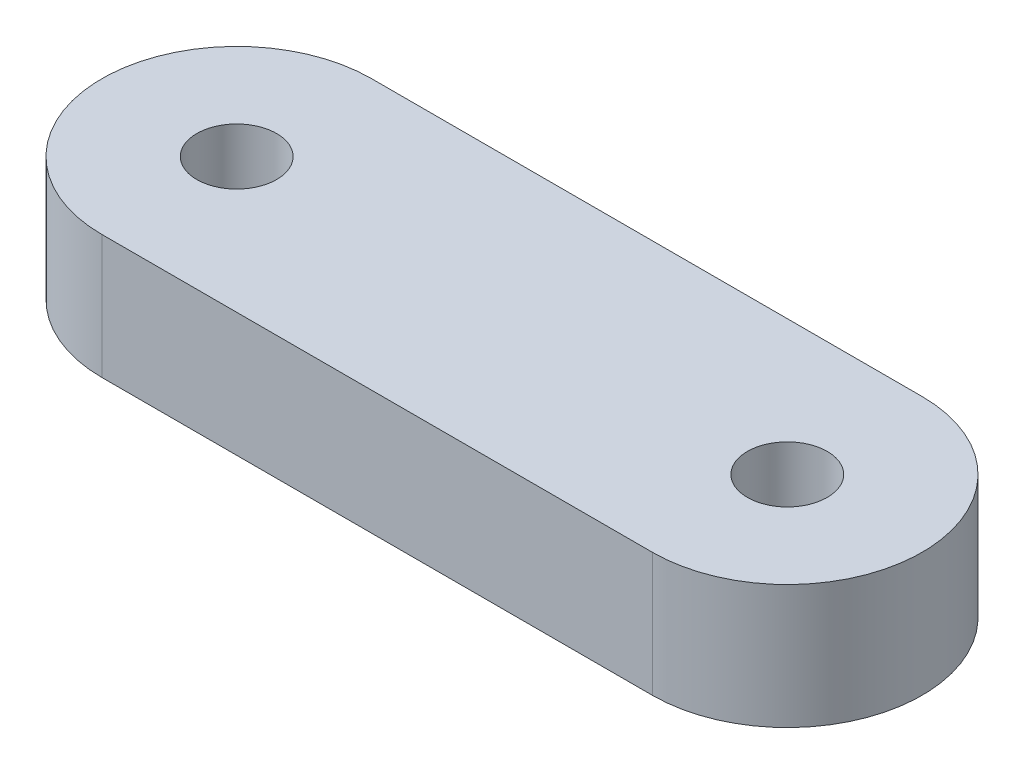
from build123d import *

# Parameters (mm, degrees)
SKETCH1_R           = 1.45
BOSS_EXTRUDE1_DEPTH = 4.5


with BuildPart() as part:
    # Sketch1 → Boss-Extrude1 (new body)
    with BuildSketch(Plane(origin=(0, 0, 0), x_dir=(1, 0, 0), z_dir=(0, 1, 0))):
        with BuildLine():
            Line((-10.000000241, 4.9), (10.000000241, 4.9))
            ThreePointArc((10.000000241, 4.9), (14.9, 0), (10.000000241, -4.9))
            Line((10.000000241, -4.9), (-10.000000241, -4.9))
            ThreePointArc((-10.000000241, -4.9), (-14.9, 0), (-10.000000241, 4.9))
        make_face()
        with Locations((-10, 0)):
            Circle(SKETCH1_R, mode=Mode.SUBTRACT)
        with Locations((10, 0)):
            Circle(SKETCH1_R, mode=Mode.SUBTRACT)
    extrude(amount=BOSS_EXTRUDE1_DEPTH)


solid = part.part
